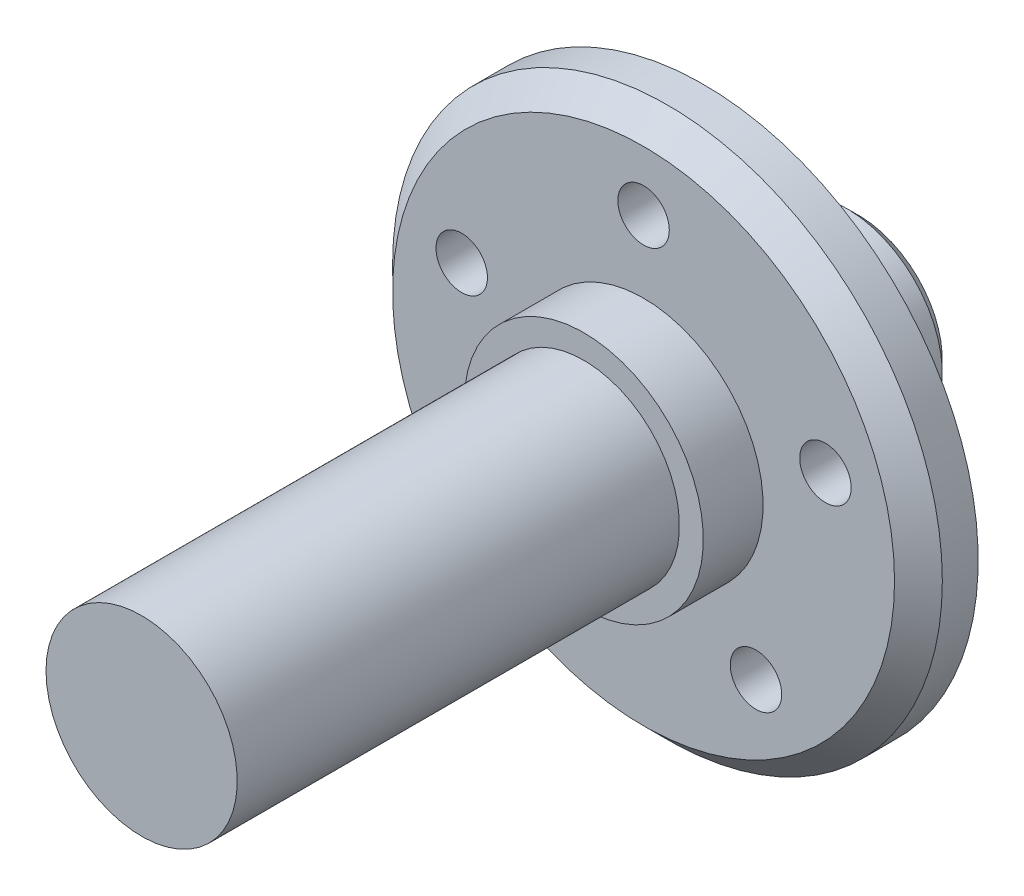
from build123d import *

# Parameters (mm, degrees)
CHAMFER1_SIZE             = 2
F_8_CLEARANCE_HOLE1_D     = 4.3053
F_8_CLEARANCE_HOLE1_DEPTH = 12
F_8_CLEARANCE_HOLE1_TIP   = 1.293442612
CHAMFER2_SIZE             = 1


with BuildPart() as part:
    # Sketch3 → Revolve1 (revolve)
    with BuildSketch(Plane(origin=(0, 0, 0), x_dir=(1, 0, 0), z_dir=(0, 1, 0))):
        Polygon((0, 0), (-8, 0), (-8, 37), (-10, 37), (-10, 42), (-23, 42), (-23, 47), (-8, 47), (-8, 60), (0, 60), align=None)
    revolve(axis=Axis((0, 0, -60), (0, 0, 1)))

    # Chamfer1
    chamfer1_edges = [part.edges().sort_by_distance(p)[0] for p in [
        (23, 0, -42),
    ]]
    chamfer(chamfer1_edges, length=CHAMFER1_SIZE)

    # #8 Clearance Hole1
    with Locations(Plane.XY.offset(-42)):
        with Locations((0, 16), (15.216904261, 4.94427191), (9.404564037, -12.94427191), (-9.404564037, -12.94427191), (-15.216904261, 4.94427191)):
            Hole(F_8_CLEARANCE_HOLE1_D / 2, depth=F_8_CLEARANCE_HOLE1_DEPTH)
            with Locations((0, 0, -(F_8_CLEARANCE_HOLE1_DEPTH + F_8_CLEARANCE_HOLE1_TIP / 2))):  # 118° drill point
                Cone(0, F_8_CLEARANCE_HOLE1_D / 2, F_8_CLEARANCE_HOLE1_TIP, mode=Mode.SUBTRACT)

    # Chamfer2
    chamfer2_edges = [part.edges().sort_by_distance(p)[0] for p in [
        (8, 0, -60),
    ]]
    chamfer(chamfer2_edges, length=CHAMFER2_SIZE)


solid = part.part
